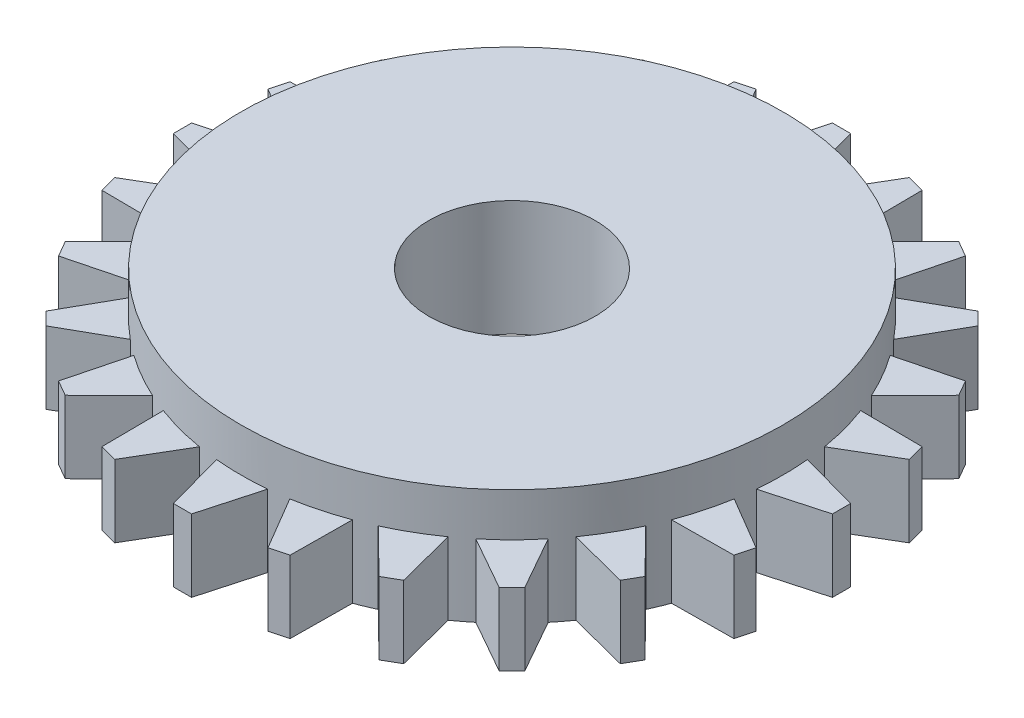
from build123d import *

# Parameters (mm, degrees)
SKETCH1_R           = 7.5
SKETCH1_R_2         = 2.3
BOSS_EXTRUDE1_DEPTH = 3.2
BOSS_EXTRUDE2_DEPTH = 2
CIRPATTERN1_COUNT   = 24


with BuildPart() as part:
    # Sketch1 → Boss-Extrude1 (new body)
    with BuildSketch(Plane(origin=(0, 0, 0), x_dir=(1, 0, 0), z_dir=(0, 1, 0))):
        Circle(SKETCH1_R)
        Circle(SKETCH1_R_2, mode=Mode.SUBTRACT)
    extrude(amount=BOSS_EXTRUDE1_DEPTH)

    # Sketch2 → Boss-Extrude2 (add)
    with BuildSketch(Plane.XZ):
        Polygon((9.114493261, 0.25), (9.114493261, -0.25), (7.314493261, -0.75), (7.314493261, 0.75), align=None)
    boss_extrude2 = extrude(amount=-BOSS_EXTRUDE2_DEPTH)

    # CirPattern1: Boss-Extrude2 ×24 about axis
    cirpattern1_axis = Axis((0, 0, 0), (0, 1, 0))
    for i in range(1, CIRPATTERN1_COUNT):
        add(boss_extrude2.rotate(cirpattern1_axis, i * 360 / CIRPATTERN1_COUNT))


solid = part.part
